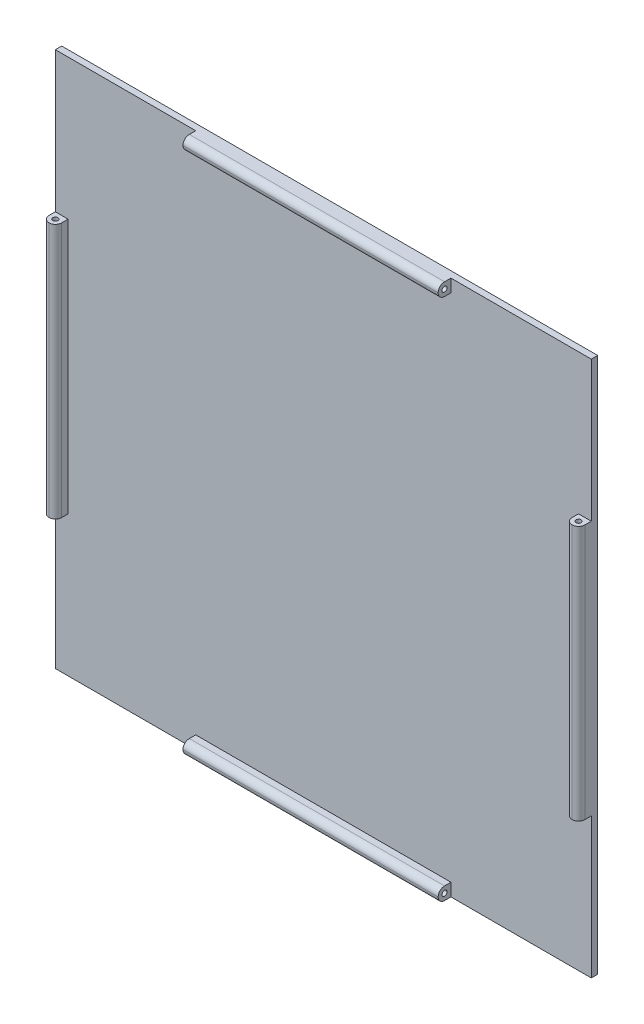
from build123d import *

# Parameters (mm, degrees)
SKETCH_1_W               = 420
SKETCH_1_H               = 420
EXTRUDE_1_DEPTH          = 5
SKETCH_3_W               = 50
SKETCH_3_H               = 10
SKETCH_3_W_2             = 10
SKETCH_3_H_2             = 50
EXTRUDE_2_DEPTH          = 10
SKETCH_4_W               = 200
SKETCH_4_H               = 10
SKETCH_4_W_2             = 10
SKETCH_4_H_2             = 200
EXTRUDE_3_DEPTH          = 10
FILLET_1_R               = 5
SKETCH_5_R               = 2
CUT_EXTRUDE_1_DEPTH      = 422.366823564
SKETCH_6_R               = 2
CUT_EXTRUDE_2_DEPTH      = 375.733238451
CUT_EXTRUDE_3_DEPTH      = 422.366823564
CUT_EXTRUDE_3_DEPTH_BACK = 422.366823564
SKETCH_7_R               = 2
SKETCH_8_R               = 2
CUT_EXTRUDE_4_DEPTH      = 375.733238451
CUT_EXTRUDE_5_DEPTH      = 422.366823564
CUT_EXTRUDE_5_DEPTH_BACK = 422.366823564
SKETCH_9_R               = 2
SKETCH_10_R              = 2
CUT_EXTRUDE_6_DEPTH      = 375.733238451
CUT_EXTRUDE_7_DEPTH      = 422.366823564
CUT_EXTRUDE_7_DEPTH_BACK = 422.366823564
SKETCH_11_R              = 2
SKETCH_12_R              = 2
CUT_EXTRUDE_8_DEPTH      = 375.733238451
SCALE_1_SCALE            = 0.5
SKETCH_13_W              = 210
SKETCH_13_H              = 210
CUT_EXTRUDE_9_DEPTH      = 90
SKETCH_14_W              = 100
SKETCH_14_H              = 100
EXTRUDE_4_DEPTH          = 12
FILLET_2_R               = 12
SKETCH_15_R              = 2
CUT_EXTRUDE_10_DEPTH     = 5


with BuildPart() as part:
    # 草图1 → 凸台-拉伸1 (new body)
    with BuildSketch(Plane.XY):
        Rectangle(SKETCH_1_W, SKETCH_1_H)
    extrude(amount=EXTRUDE_1_DEPTH)

    # 草图3 → 凸台-拉伸2 (add)
    with BuildSketch(Plane(origin=(0, 0, 0), x_dir=(-1, 0, 0), z_dir=(0, 0, -1))):
        with Locations((-130, -205)):
            Rectangle(SKETCH_3_W, SKETCH_3_H)
        with Locations((-205, -130)):
            Rectangle(SKETCH_3_W_2, SKETCH_3_H_2)
        with Locations((-205, 130)):
            Rectangle(SKETCH_3_W_2, SKETCH_3_H_2)
        with Locations((-130, 205)):
            Rectangle(SKETCH_3_W, SKETCH_3_H)
        with Locations((205, 130)):
            Rectangle(SKETCH_3_W_2, SKETCH_3_H_2)
        with Locations((130, 205)):
            Rectangle(SKETCH_3_W, SKETCH_3_H)
        with Locations((205, -130)):
            Rectangle(SKETCH_3_W_2, SKETCH_3_H_2)
        with Locations((130, -205)):
            Rectangle(SKETCH_3_W, SKETCH_3_H)
    extrude(amount=EXTRUDE_2_DEPTH)

    # 草图4 → 凸台-拉伸3 (add)
    with BuildSketch(Plane.XY.offset(5)):
        with Locations((0, -205)):
            Rectangle(SKETCH_4_W, SKETCH_4_H)
        with Locations((205, 0)):
            Rectangle(SKETCH_4_W_2, SKETCH_4_H_2)
        with Locations((0, 205)):
            Rectangle(SKETCH_4_W, SKETCH_4_H)
        with Locations((-205, 0)):
            Rectangle(SKETCH_4_W_2, SKETCH_4_H_2)
    extrude(amount=EXTRUDE_3_DEPTH)

    # 圆角1
    fillet_1_edges = [part.edges().sort_by_distance(p)[0] for p in [
        (-210, 0, 15),
        (-200, 0, 15),
        (0, -210, 15),
        (0, -200, 15),
        (0, 200, 15),
        (0, 210, 15),
        (200, 0, 15),
        (210, 0, 15),
        (200, -130, -10),
        (210, -130, -10),
        (130, 210, -10),
        (130, 200, -10),
        (200, 130, -10),
        (210, 130, -10),
        (-130, -200, -10),
        (-130, -210, -10),
        (-130, 210, -10),
        (-130, 200, -10),
        (-210, 130, -10),
        (-200, 130, -10),
        (-210, -130, -10),
        (-200, -130, -10),
        (130, -200, -10),
        (130, -210, -10),
    ]]
    fillet(fillet_1_edges, radius=FILLET_1_R - 0.0001)  # a hair under: the kernel refuses the full size

    # 草图5 → 切除-拉伸1 (cut, through all)
    with BuildSketch(Plane(origin=(0, 155, 0), x_dir=(1, 0, 0), z_dir=(0, 1, 0))):
        with Locations(Location((205, 5, 0), (0, 0, 270))):
            Circle(SKETCH_5_R)
    extrude(amount=-CUT_EXTRUDE_1_DEPTH, mode=Mode.SUBTRACT)

    # 草图6 → 切除-拉伸2 (cut, through all)
    with BuildSketch(Plane(origin=(0, 100, 0), x_dir=(1, 0, 0), z_dir=(0, 1, 0))):
        with Locations(Location((205, -10, 0), (0, 0, 270))):
            Circle(SKETCH_6_R)
    extrude(amount=-CUT_EXTRUDE_2_DEPTH, mode=Mode.SUBTRACT)

    # 草图7 → 切除-拉伸3 (cut, two sides: drawn at the far end of the back side and taken through both)
    with BuildSketch(Plane(origin=(155, 0, 0), x_dir=(0, 0, -1), z_dir=(1, 0, 0)).offset(-CUT_EXTRUDE_3_DEPTH_BACK)):
        with Locations((5, -205)):
            Circle(SKETCH_7_R)
    extrude(amount=CUT_EXTRUDE_3_DEPTH + CUT_EXTRUDE_3_DEPTH_BACK, mode=Mode.SUBTRACT)

    # 草图8 → 切除-拉伸4 (cut, through all)
    with BuildSketch(Plane(origin=(100, 0, 0), x_dir=(0, 0, -1), z_dir=(1, 0, 0))):
        with Locations((-10, -205)):
            Circle(SKETCH_8_R)
    extrude(amount=-CUT_EXTRUDE_4_DEPTH, mode=Mode.SUBTRACT)

    # 草图9 → 切除-拉伸5 (cut, two sides: drawn at the far end of the back side and taken through both)
    with BuildSketch(Plane.XZ.offset(155).offset(-CUT_EXTRUDE_5_DEPTH_BACK)):
        with Locations((-205, -5)):
            Circle(SKETCH_9_R)
    extrude(amount=CUT_EXTRUDE_5_DEPTH + CUT_EXTRUDE_5_DEPTH_BACK, mode=Mode.SUBTRACT)

    # 草图10 → 切除-拉伸6 (cut, through all)
    with BuildSketch(Plane.XZ.offset(100)):
        with Locations(Location((-205, 10, 0), (0, 0, 270))):
            Circle(SKETCH_10_R)
    extrude(amount=-CUT_EXTRUDE_6_DEPTH, mode=Mode.SUBTRACT)

    # 草图11 → 切除-拉伸7 (cut, two sides: drawn at the far end of the back side and taken through both)
    with BuildSketch(Plane.ZY.offset(155).offset(-CUT_EXTRUDE_7_DEPTH_BACK)):
        with Locations(Location((-5, 205, 0), (0, 0, 270))):
            Circle(SKETCH_11_R)
    extrude(amount=CUT_EXTRUDE_7_DEPTH + CUT_EXTRUDE_7_DEPTH_BACK, mode=Mode.SUBTRACT)

    # 草图12 → 切除-拉伸8 (cut, through all)
    with BuildSketch(Plane.ZY.offset(100)):
        with Locations((10, 205)):
            Circle(SKETCH_12_R)
    extrude(amount=-CUT_EXTRUDE_8_DEPTH, mode=Mode.SUBTRACT)


with BuildPart() as part_1:
    # 缩放比例1: scaled about (0, 0, 0)
    add(part.part.scale(SCALE_1_SCALE))

    # 草图13 → 切除-拉伸9 (cut)
    with BuildSketch(Plane(origin=(0, 0, 0), x_dir=(-1, 0, 0), z_dir=(0, 0, -1))):
        Rectangle(SKETCH_13_W, SKETCH_13_H)
    extrude(amount=CUT_EXTRUDE_9_DEPTH, mode=Mode.SUBTRACT)

    # 草图14 → 凸台-拉伸4 (add)
    with BuildSketch(Plane(origin=(0, 0, 0), x_dir=(-1, 0, 0), z_dir=(0, 0, -1))):
        Rectangle(SKETCH_14_W, SKETCH_14_H)
    extrude(amount=EXTRUDE_4_DEPTH)

    # 圆角2
    fillet_2_edges = [part_1.edges().sort_by_distance(p)[0] for p in [
        (50, 0, 0),
        (0, -50, 0),
        (-50, 0, 0),
        (0, 50, 0),
    ]]
    fillet(fillet_2_edges, radius=FILLET_2_R - 0.0001)  # a hair under: the kernel refuses the full size

    # 草图15 → 切除-拉伸10 (cut)
    with BuildSketch(Plane(origin=(0, 0, -12), x_dir=(-1, 0, 0), z_dir=(0, 0, -1))):
        with Locations((-35, 35)):
            Circle(SKETCH_15_R)
        with Locations((35, 35)):
            Circle(SKETCH_15_R)
        with Locations((-35, -35)):
            Circle(SKETCH_15_R)
        with Locations((35, -35)):
            Circle(SKETCH_15_R)
    extrude(amount=-CUT_EXTRUDE_10_DEPTH, mode=Mode.SUBTRACT)


solid = part_1.part
